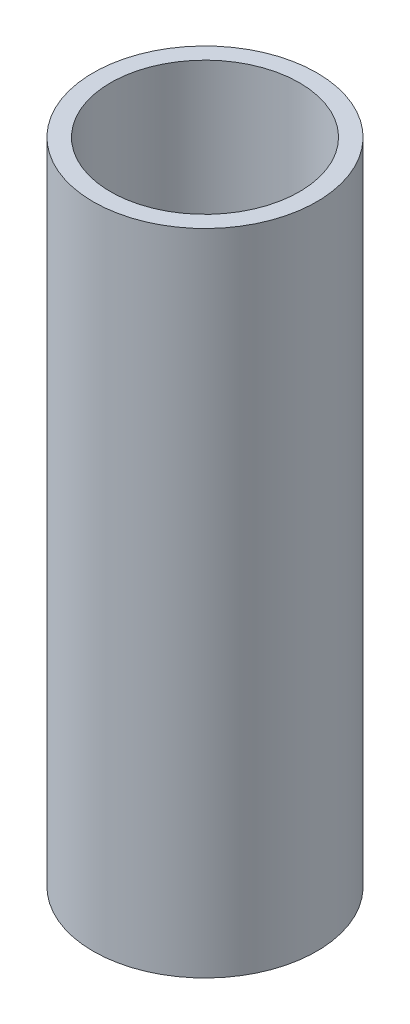
from build123d import *

# Parameters (mm, degrees)
SKETCH1_R           = 20
BOSS_EXTRUDE1_DEPTH = 116.13062426
SKETCH2_R           = 16.89881269
CUT_EXTRUDE1_DEPTH  = 120.525402702


with BuildPart() as part:
    # Sketch1 → Boss-Extrude1 (new body)
    with BuildSketch(Plane(origin=(0, 0, 0), x_dir=(1, 0, 0), z_dir=(0, 1, 0))):
        Circle(SKETCH1_R)
    extrude(amount=BOSS_EXTRUDE1_DEPTH)

    # Sketch2 → Cut-Extrude1 (cut, through all)
    with BuildSketch(Plane(origin=(0, 0, 0), x_dir=(1, 0, 0), z_dir=(0, 1, 0))):
        Circle(SKETCH2_R)
    extrude(amount=CUT_EXTRUDE1_DEPTH, mode=Mode.SUBTRACT)


solid = part.part
